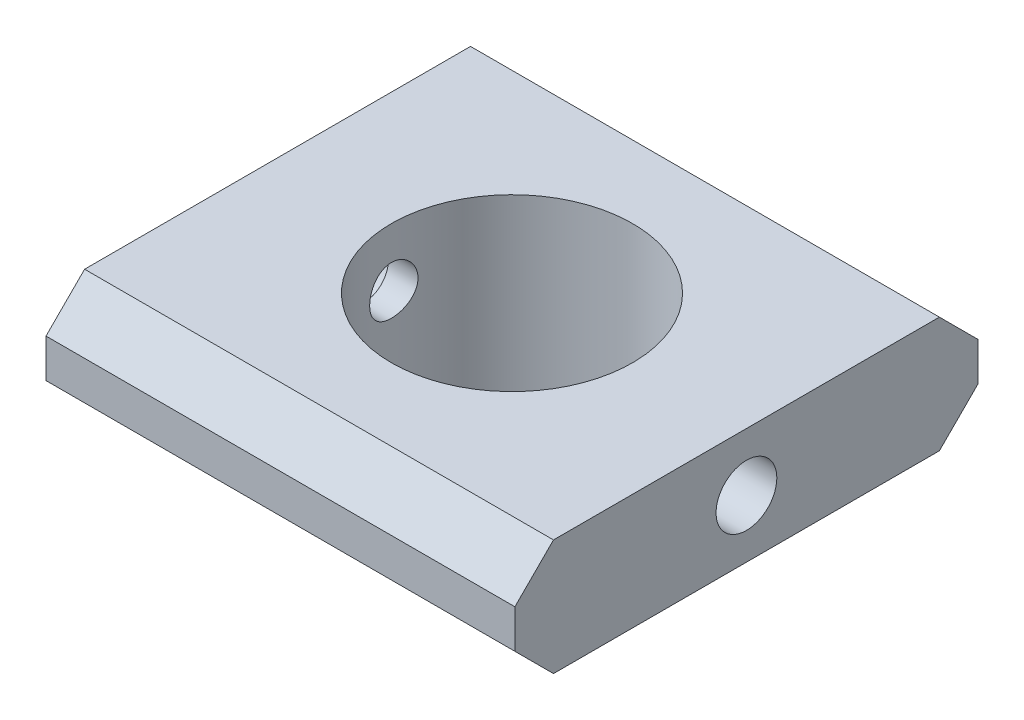
from build123d import *

# Parameters (mm, degrees)
BOSS_EXTRUDE1_DEPTH      = 2.54
BOSS_EXTRUDE1_DEPTH_BACK = 2.54
SKETCH4_R                = 10.16
CUT_EXTRUDE1_DEPTH       = 1.27
CUT_EXTRUDE1_DEPTH_BACK  = 1.27
SKETCH5_R                = 10.16
SKETCH5_R_2              = 8.89
FILLET1_R                = 1.27
SKETCH6_R                = 7.9375
CUT_EXTRUDE2_DEPTH       = 16.24
SKETCH7_W                = 30.48
SKETCH7_H                = 30.48
SKETCH7_R                = 10.16
BOSS_EXTRUDE2_DEPTH      = 1.27
BOSS_EXTRUDE3_START      = 1.27
SKETCH8_W                = 30.48
SKETCH8_H                = 30.48
SKETCH8_R                = 7.9375
BOSS_EXTRUDE3_DEPTH      = 1.27
CUT_EXTRUDE3_DEPTH       = 35.29
CUT_EXTRUDE4_DEPTH       = 22.886783683
CUT_EXTRUDE5_DEPTH       = 22.886783683
CUT_EXTRUDE6_DEPTH       = 22.886783683
SKETCH14_W               = 7.62
SKETCH14_H               = 9.930781058
CUT_EXTRUDE7_DEPTH       = 22.886783683
BOSS_EXTRUDE4_START      = 5.08
SKETCH15_W               = 22.86
SKETCH15_H               = 30.48
SKETCH15_R               = 7.9375
BOSS_EXTRUDE4_DEPTH      = 5.08
CUT_EXTRUDE8_DEPTH       = 22.022240604
CUT_EXTRUDE8_DEPTH_BACK  = 22.022240604
SKETCH16_R               = 1.59
SKETCH18_R               = 2
BOSS_EXTRUDE5_DEPTH      = 4
SKETCH19_R               = 2
CUT_EXTRUDE9_DEPTH       = 5.7
CHAMFER1_SIZE            = 2.54


with BuildPart() as part:
    # Sketch4 → Boss-Extrude1 (new, two sides: drawn at the far end of the back side and taken through both)
    with BuildSketch(Plane(origin=(0, 0, 0), x_dir=(1, 0, 0), z_dir=(0, 1, 0)).offset(-BOSS_EXTRUDE1_DEPTH_BACK)):
        with Locations(Location((0, 0, 0), (0, 0, 270))):
            Circle(SKETCH4_R)
    extrude(amount=BOSS_EXTRUDE1_DEPTH + BOSS_EXTRUDE1_DEPTH_BACK)

    # Sketch5 → Cut-Extrude1 (cut, two sides: drawn at the far end of the back side and taken through both)
    with BuildSketch(Plane(origin=(0, 0, 0), x_dir=(1, 0, 0), z_dir=(0, 1, 0)).offset(-CUT_EXTRUDE1_DEPTH_BACK)):
        with Locations(Location((0, 0, 0), (0, 0, 270))):
            Circle(SKETCH5_R)
        with Locations(Location((0, 0, 0), (0, 0, 270))):
            Circle(SKETCH5_R_2, mode=Mode.SUBTRACT)
    extrude(amount=CUT_EXTRUDE1_DEPTH + CUT_EXTRUDE1_DEPTH_BACK, mode=Mode.SUBTRACT)

    # Fillet1
    fillet1_edges = [part.edges().sort_by_distance(p)[0] for p in [
        (0, 1.27, -8.89),
        (0, -1.27, -8.89),
    ]]
    fillet(fillet1_edges, radius=FILLET1_R - 0.0001)  # a hair under: the kernel refuses the full size

    # Sketch6 → Cut-Extrude2 (cut, through all)
    with BuildSketch(Plane(origin=(0, 2.54, 0), x_dir=(1, 0, 0), z_dir=(0, 1, 0))):
        with Locations(Location((0, 0, 0), (0, 0, 270))):
            Circle(SKETCH6_R)
    extrude(amount=-CUT_EXTRUDE2_DEPTH, mode=Mode.SUBTRACT)

    # Sketch7 → Boss-Extrude2 (add)
    with BuildSketch(Plane(origin=(0, 2.54, 0), x_dir=(1, 0, 0), z_dir=(0, 1, 0))):
        Rectangle(SKETCH7_W, SKETCH7_H)
        with Locations(Location((0, 0, 0), (0, 0, 270))):
            Circle(SKETCH7_R, mode=Mode.SUBTRACT)
    extrude(amount=-BOSS_EXTRUDE2_DEPTH)

    # Sketch8 → Boss-Extrude3 (add)
    with BuildSketch(Plane(origin=(0, 2.54, 0), x_dir=(1, 0, 0), z_dir=(0, 1, 0)).offset(BOSS_EXTRUDE3_START)):
        Rectangle(SKETCH8_W, SKETCH8_H)
        with Locations(Location((0, 0, 0), (0, 0, 270))):
            Circle(SKETCH8_R, mode=Mode.SUBTRACT)
    extrude(amount=-BOSS_EXTRUDE3_DEPTH)

    # Sketch9 → Cut-Extrude3 (cut, through all)
    with BuildSketch(Plane.XY.offset(15.24)):
        Polygon((-15.24, 3.81), (-15.24, 1.27), (-12.7, 1.27), align=None)
    cut_extrude3 = extrude(amount=-CUT_EXTRUDE3_DEPTH, mode=Mode.SUBTRACT)

    # Mirror2: Cut-Extrude3 across plane
    add(cut_extrude3.mirror(Plane(origin=(0, 0, 0), x_dir=(0, 0, 1), z_dir=(1, 0, 0))), mode=Mode.SUBTRACT)

    # Sketch11 → Cut-Extrude4 (cut, symmetric)
    with BuildSketch(Plane(origin=(0, 0, 0), x_dir=(0, 0, -1), z_dir=(1, 0, 0))):
        Polygon((-15.24, 3.81), (-12.7, 1.27), (-15.24, 1.27), align=None)
    cut_extrude4 = extrude(amount=CUT_EXTRUDE4_DEPTH, both=True, mode=Mode.SUBTRACT)

    # Mirror3: Cut-Extrude4 across plane
    add(cut_extrude4.mirror(Plane.XY), mode=Mode.SUBTRACT)

    # Sketch12 → Cut-Extrude5 (cut, symmetric)
    with BuildSketch(Plane(origin=(0, 0, 0), x_dir=(0, 0, -1), z_dir=(1, 0, 0))):
        Polygon((-15.24, 3.81), (-5.498295506, -5.931704494), (-15.24, -5.931704494), align=None)
    cut_extrude5 = extrude(amount=CUT_EXTRUDE5_DEPTH, both=True, mode=Mode.SUBTRACT)

    # Mirror4: Cut-Extrude5 across plane
    add(cut_extrude5.mirror(Plane.XY), mode=Mode.SUBTRACT)

    # Sketch13 → Cut-Extrude6 (cut, symmetric)
    with BuildSketch(Plane.XY):
        Polygon((-15.24, 3.81), (-1.428921465, -10.001078535), (-15.24, -10.001078535), align=None)
    cut_extrude6 = extrude(amount=CUT_EXTRUDE6_DEPTH, both=True, mode=Mode.SUBTRACT)

    # Mirror5: Cut-Extrude6 across plane
    add(cut_extrude6.mirror(Plane(origin=(0, 0, 0), x_dir=(0, 0, 1), z_dir=(1, 0, 0))), mode=Mode.SUBTRACT)

    # Sketch14 → Cut-Extrude7 (cut, symmetric)
    with BuildSketch(Plane.XY):
        with Locations((-15.24, 3.81)):
            Rectangle(SKETCH14_W, SKETCH14_H)
    cut_extrude7 = extrude(amount=CUT_EXTRUDE7_DEPTH, both=True, mode=Mode.SUBTRACT)

    # Mirror6: Cut-Extrude7 across plane
    add(cut_extrude7.mirror(Plane(origin=(0, 0, 0), x_dir=(0, 0, 1), z_dir=(1, 0, 0))), mode=Mode.SUBTRACT)

    # Sketch15 → Boss-Extrude4 (add)
    with BuildSketch(Plane(origin=(0, 3.81, 0), x_dir=(1, 0, 0), z_dir=(0, 1, 0)).offset(BOSS_EXTRUDE4_START)):
        Rectangle(SKETCH15_W, SKETCH15_H)
        with Locations(Location((0, 0, 0), (0, 0, 270))):
            Circle(SKETCH15_R, mode=Mode.SUBTRACT)
    extrude(amount=-BOSS_EXTRUDE4_DEPTH)

    # Sketch16 → Cut-Extrude8 (cut, two sides: drawn at the far end of the back side and taken through both)
    with BuildSketch(Plane(origin=(0, 0, 0), x_dir=(0, 0, -1), z_dir=(1, 0, 0)).offset(-CUT_EXTRUDE8_DEPTH_BACK)):
        with Locations((0, 5.08)):
            Circle(SKETCH16_R)
    extrude(amount=CUT_EXTRUDE8_DEPTH + CUT_EXTRUDE8_DEPTH_BACK, mode=Mode.SUBTRACT)

    # Sketch18 → Boss-Extrude5 (add)
    with BuildSketch(Plane(origin=(11.43, 0, 0), x_dir=(0, 0, -1), z_dir=(1, 0, 0))):
        Polygon((-15.24, 3.81), (-12.7, 1.27), (12.7, 1.27), (15.24, 3.81), (15.24, 8.89), (-15.24, 8.89), align=None)
        with Locations((0, 5.08)):
            Circle(SKETCH18_R, mode=Mode.SUBTRACT)
    boss_extrude5 = extrude(amount=BOSS_EXTRUDE5_DEPTH)

    # Mirror7: Boss-Extrude5 across plane
    add(boss_extrude5.mirror(Plane(origin=(0, 0, 0), x_dir=(0, 0, 1), z_dir=(1, 0, 0))))

    # Sketch19 → Cut-Extrude9 (cut)
    with BuildSketch(Plane(origin=(15.43, 0, 0), x_dir=(0, 0, -1), z_dir=(1, 0, 0))):
        with Locations((0, 5.08)):
            Circle(SKETCH19_R)
    cut_extrude9 = extrude(amount=-CUT_EXTRUDE9_DEPTH, mode=Mode.SUBTRACT)

    # Mirror8: Cut-Extrude9 across plane
    add(cut_extrude9.mirror(Plane(origin=(0, 0, 0), x_dir=(0, 0, 1), z_dir=(1, 0, 0))), mode=Mode.SUBTRACT)

    # Chamfer1
    chamfer1_edges = [part.edges().sort_by_distance(p)[0] for p in [
        (0, 8.89, 15.24),
        (0, 8.89, -15.24),
    ]]
    chamfer(chamfer1_edges, length=CHAMFER1_SIZE)


solid = part.part
